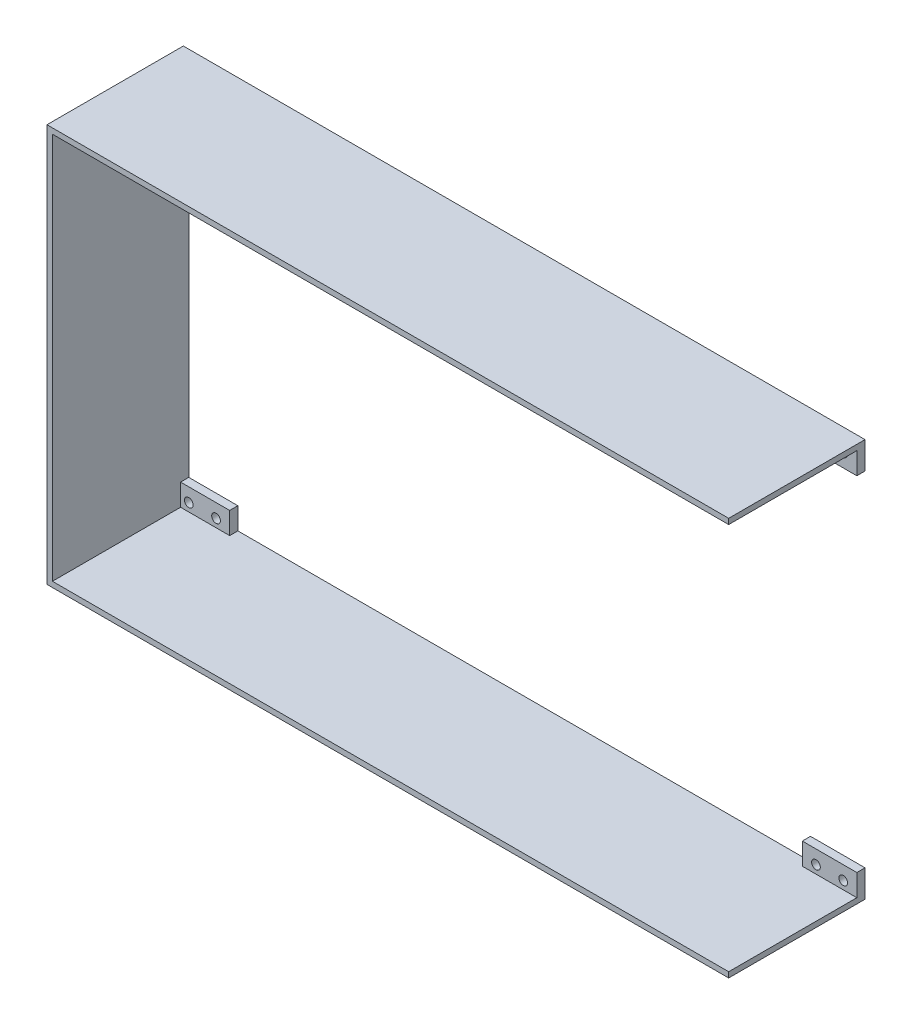
from build123d import *

# Parameters (mm, degrees)
EXTRUDE_1_DEPTH = 50
SKETCH_2_W      = 20
SKETCH_2_H      = 10
SKETCH_2_R      = 1.6
EXTRUDE_2_DEPTH = 3


with BuildPart() as part:
    # 草图1 → 凸台-拉伸1 (new body)
    with BuildSketch(Plane.XY):
        Polygon((-151.179701436, 97.04447756), (98.820298564, 97.04447756), (98.820298564, 95.04447756), (96.820298564, 95.04447756), (-149.179701436, 95.04447756), (-149.179701436, -46.95552244), (96.820298564, -46.95552244), (98.820298564, -46.95552244), (98.820298564, -48.95552244), (-151.179701436, -48.95552244), align=None)
    extrude(amount=EXTRUDE_1_DEPTH)

    # 草图2 → 凸台-拉伸2 (add)
    # profile 1 of 4: a face of its own
    with BuildSketch(Plane.XY):
        with Locations((-141.179701436, -43.95552244)):
            Rectangle(SKETCH_2_W, SKETCH_2_H)
        with Locations((-146.179701436, -43.95552244)):
            Circle(SKETCH_2_R, mode=Mode.SUBTRACT)
        with Locations((-136.179701436, -43.95552244)):
            Circle(SKETCH_2_R, mode=Mode.SUBTRACT)
    # profile 2 of 4: a face of its own
    with BuildSketch(Plane.XY):
        with Locations((88.820298564, -43.95552244)):
            Rectangle(SKETCH_2_W, SKETCH_2_H)
        with Locations((83.820298564, -43.95552244)):
            Circle(SKETCH_2_R, mode=Mode.SUBTRACT)
        with Locations((93.820298564, -43.95552244)):
            Circle(SKETCH_2_R, mode=Mode.SUBTRACT)
    # profile 3 of 4: a face of its own
    with BuildSketch(Plane.XY):
        with Locations((88.820298564, 92.04447756)):
            Rectangle(SKETCH_2_W, SKETCH_2_H)
        with Locations((93.820298564, 92.04447756)):
            Circle(SKETCH_2_R, mode=Mode.SUBTRACT)
        with Locations((83.820298564, 92.04447756)):
            Circle(SKETCH_2_R, mode=Mode.SUBTRACT)
    # profile 4 of 4: a face of its own
    with BuildSketch(Plane.XY):
        with Locations((-141.179701436, 92.04447756)):
            Rectangle(SKETCH_2_W, SKETCH_2_H)
        with Locations((-136.179701436, 92.04447756)):
            Circle(SKETCH_2_R, mode=Mode.SUBTRACT)
        with Locations((-146.179701436, 92.04447756)):
            Circle(SKETCH_2_R, mode=Mode.SUBTRACT)
    extrude(amount=EXTRUDE_2_DEPTH)


solid = part.part
